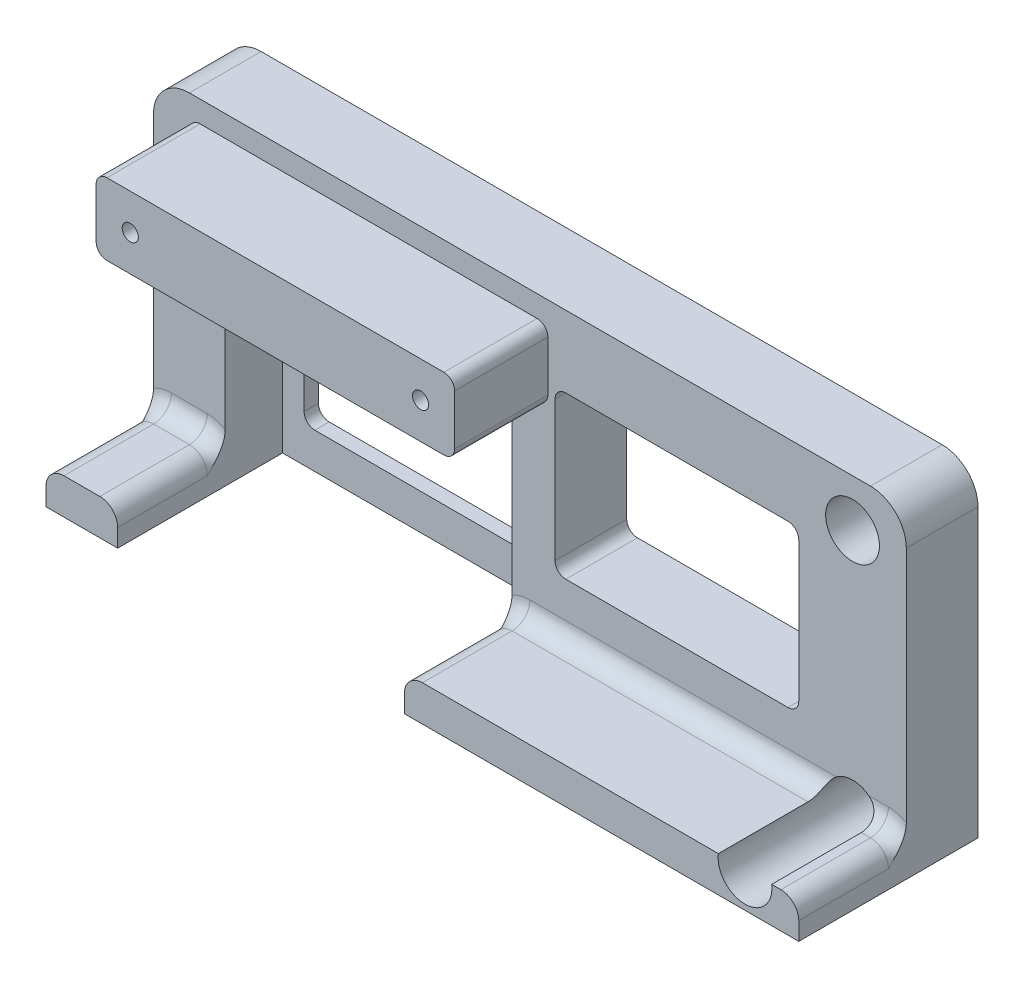
from build123d import *

# Parameters (mm, degrees)
SKETCH1_W           = 210
SKETCH1_H           = 90
BOSS_EXTRUDE1_DEPTH = 20
SKETCH2_R           = 1.6
CUT_EXTRUDE1_DEPTH  = 20
SKETCH3_W           = 110
SKETCH3_H           = 10
BOSS_EXTRUDE2_DEPTH = 30
SKETCH4_W           = 100
SKETCH4_H           = 20
BOSS_EXTRUDE3_DEPTH = 26
SKETCH5_R           = 2.25
CUT_EXTRUDE2_DEPTH  = 234.057932712
SKETCH7_W           = 80
SKETCH7_H           = 64
CUT_EXTRUDE3_DEPTH  = 16
SKETCH8_R           = 7.5
CUT_EXTRUDE4_DEPTH  = 12
SKETCH9_R           = 7.5
CUT_EXTRUDE5_DEPTH  = 42
SKETCH10_W          = 68
SKETCH10_H          = 45
CUT_EXTRUDE6_DEPTH  = 46
SKETCH11_W          = 20
SKETCH11_H          = 10
BOSS_EXTRUDE5_DEPTH = 30
FILLET1_R           = 10
SKETCH12_W          = 68
SKETCH12_H          = 46
CUT_EXTRUDE7_DEPTH  = 30
FILLET2_R           = 5
FILLET3_R           = 5
FILLET4_R           = 3
FILLET5_R           = 3


with BuildPart() as part:
    # Sketch1 → Boss-Extrude1 (new body)
    with BuildSketch(Plane.XY):
        with Locations((105, -45)):
            Rectangle(SKETCH1_W, SKETCH1_H)
    extrude(amount=BOSS_EXTRUDE1_DEPTH)

    # Sketch2 → Cut-Extrude1 (cut)
    with BuildSketch(Plane.XY.offset(20)):
        with Locations((195, -13.2)):
            Circle(SKETCH2_R)
        with Locations((195, -81)):
            Circle(SKETCH2_R)
    extrude(amount=-CUT_EXTRUDE1_DEPTH, mode=Mode.SUBTRACT)

    # Sketch3 → Boss-Extrude2 (add)
    with BuildSketch(Plane.XY.offset(20)):
        with Locations((155, -85)):
            Rectangle(SKETCH3_W, SKETCH3_H)
    extrude(amount=BOSS_EXTRUDE2_DEPTH)

    # Sketch4 → Boss-Extrude3 (add)
    with BuildSketch(Plane.XY.offset(20)):
        with Locations((60, -16)):
            Rectangle(SKETCH4_W, SKETCH4_H)
    extrude(amount=BOSS_EXTRUDE3_DEPTH)

    # Sketch5 → Cut-Extrude2 (cut, through all)
    with BuildSketch(Plane.XY.offset(46)):
        with Locations((100.5, -16)):
            Circle(SKETCH5_R)
        with Locations((19.5, -16)):
            Circle(SKETCH5_R)
    extrude(amount=-CUT_EXTRUDE2_DEPTH, mode=Mode.SUBTRACT)

    # Sketch7 → Cut-Extrude3 (cut)
    with BuildSketch(Plane.XY.offset(20)):
        with Locations((60, -58)):
            Rectangle(SKETCH7_W, SKETCH7_H)
    extrude(amount=-CUT_EXTRUDE3_DEPTH, mode=Mode.SUBTRACT)

    # Sketch8 → Cut-Extrude4 (cut)
    with BuildSketch(Plane.XY.offset(20)):
        with Locations((195, -13.2)):
            Circle(SKETCH8_R)
    extrude(amount=-CUT_EXTRUDE4_DEPTH, mode=Mode.SUBTRACT)

    # Sketch9 → Cut-Extrude5 (cut)
    with BuildSketch(Plane.XY.offset(50)):
        with Locations((195, -81)):
            Circle(SKETCH9_R)
    extrude(amount=-CUT_EXTRUDE5_DEPTH, mode=Mode.SUBTRACT)

    # Sketch10 → Cut-Extrude6 (cut)
    with BuildSketch(Plane.XY.offset(20)):
        with Locations((146, -42.5)):
            Rectangle(SKETCH10_W, SKETCH10_H)
    extrude(amount=-CUT_EXTRUDE6_DEPTH, mode=Mode.SUBTRACT)

    # Sketch11 → Boss-Extrude5 (add)
    with BuildSketch(Plane.XY.offset(20)):
        with Locations((10, -85)):
            Rectangle(SKETCH11_W, SKETCH11_H)
    extrude(amount=BOSS_EXTRUDE5_DEPTH)

    # Fillet1
    fillet1_edges = [part.edges().sort_by_distance(p)[0] for p in [
        (0, 0, 10),
        (210, 0, 10),
    ]]
    fillet(fillet1_edges, radius=FILLET1_R)

    # Sketch12 → Cut-Extrude7 (cut)
    with BuildSketch(Plane.XY.offset(4)):
        with Locations((60, -57)):
            Rectangle(SKETCH12_W, SKETCH12_H)
    extrude(amount=-CUT_EXTRUDE7_DEPTH, mode=Mode.SUBTRACT)

    # Fillet2
    fillet2_edges = [part.edges().sort_by_distance(p)[0] for p in [
        (0, -80, 35),
        (20, -80, 35),
        (210, -80, 35),
        (100, -80, 35),
    ]]
    fillet(fillet2_edges, radius=FILLET2_R)

    # Fillet3
    # the kernel refuses this fillet: 5 mm, written as the material it adds along each edge
    with BuildSketch(Plane(origin=(189.933034374, -80, 20), x_dir=(0, 1, 0), z_dir=(1, 0, 0))) as fillet3_piece_1_section:
        with BuildLine():
            CenterArc((FILLET3_R, FILLET3_R), FILLET3_R, 180, 90)
            Line((0, FILLET3_R), (0, 0))
            Line((0, 0), (FILLET3_R, 0))
        make_face()
    fillet3_piece_1 = extrude(amount=15.066965626, mode=Mode.PRIVATE)
    fillet3_piece_1 = fillet3_piece_1 - Plane(origin=(195, -81, 20.004383527), x_dir=(1, 0, 0), z_dir=(0, 0, 1)) * Cylinder(7.5, 51, mode=Mode.PRIVATE)
    add(fillet3_piece_1)
    with BuildSketch(Plane(origin=(15, -80, 20), x_dir=(0, 1, 0), z_dir=(-1, 0, 0))) as fillet3_piece_2:
        with BuildLine():
            CenterArc((FILLET3_R, -FILLET3_R), FILLET3_R, 90, 90)
            Line((0, -FILLET3_R), (0, 0))
            Line((0, 0), (FILLET3_R, 0))
        make_face()
    extrude(amount=10)
    with BuildSketch(Plane(origin=(205, -85, 20), x_dir=(-0.801744239297649, -0.5976672776328267, 0), z_dir=(-0.5976672776328267, 0.801744239297649, 0))) as fillet3_piece_3_section:
        with BuildLine():
            CenterArc((5 + FILLET3_R, FILLET3_R), FILLET3_R, 180, 90)
            Line((5, FILLET3_R), (5, 0))
            Line((5, 0), (5 + FILLET3_R, 0))
        make_face()
    fillet3_piece_3 = revolve(axis=Axis((205, -85, 20), (0, 0, 1)), revolution_arc=233.296989237, mode=Mode.PRIVATE)
    fillet3_piece_3 = split(fillet3_piece_3, bisect_by=Plane(origin=(208.749694825, -90, 21.558141558), z_dir=(0, 1, 0)), keep=Keep.TOP, mode=Mode.PRIVATE)
    fillet3_piece_3 = split(fillet3_piece_3, bisect_by=Plane(origin=(210, -81.250305307, 21.558141558), z_dir=(-1, 0, 0)), keep=Keep.TOP, mode=Mode.PRIVATE)
    add(fillet3_piece_3)
    with BuildSketch(Plane(origin=(105, -85, 20), x_dir=(0, 1, 0), z_dir=(1, 0, 0))) as fillet3_piece_4_section:
        with BuildLine():
            CenterArc((5 + FILLET3_R, FILLET3_R), FILLET3_R, 180, 90)
            Line((5, FILLET3_R), (5, 0))
            Line((5, 0), (5 + FILLET3_R, 0))
        make_face()
    fillet3_piece_4 = revolve(axis=Axis((105, -85, 20), (0, 0, 1)), revolution_arc=233.296989237, mode=Mode.PRIVATE)
    fillet3_piece_4 = split(fillet3_piece_4, bisect_by=Plane(origin=(103.049091377, -90, 20.836500951), z_dir=(0, 1, 0)), keep=Keep.TOP, mode=Mode.PRIVATE)
    fillet3_piece_4 = split(fillet3_piece_4, bisect_by=Plane(origin=(100, -78.901123736, 20.836500951), z_dir=(1, 0, 0)), keep=Keep.TOP, mode=Mode.PRIVATE)
    add(fillet3_piece_4)
    with BuildSketch(Plane(origin=(15, -85, 20), x_dir=(0, 1, 0), z_dir=(-1, 0, 0))) as fillet3_piece_5_section:
        with BuildLine():
            CenterArc((5 + FILLET3_R, -FILLET3_R), FILLET3_R, 90, 90)
            Line((5, -FILLET3_R), (5, 0))
            Line((5, 0), (5 + FILLET3_R, 0))
        make_face()
    fillet3_piece_5 = revolve(axis=Axis((15, -85, 20), (0, 0, -1)), revolution_arc=233.296989237, mode=Mode.PRIVATE)
    fillet3_piece_5 = split(fillet3_piece_5, bisect_by=Plane(origin=(16.950908623, -90, 20.836500951), z_dir=(0, 1, 0)), keep=Keep.TOP, mode=Mode.PRIVATE)
    fillet3_piece_5 = split(fillet3_piece_5, bisect_by=Plane(origin=(20, -78.901123736, 20.836500951), z_dir=(-1, 0, 0)), keep=Keep.TOP, mode=Mode.PRIVATE)
    add(fillet3_piece_5)
    with BuildSketch(Plane(origin=(5, -85, 20), x_dir=(0.8017442392976476, -0.5976672776328283, 0), z_dir=(0.5976672776328283, 0.8017442392976476, 0))) as fillet3_piece_6_section:
        with BuildLine():
            CenterArc((5 + FILLET3_R, -FILLET3_R), FILLET3_R, 90, 90)
            Line((5, -FILLET3_R), (5, 0))
            Line((5, 0), (5 + FILLET3_R, 0))
        make_face()
    fillet3_piece_6 = revolve(axis=Axis((5, -85, 20), (0, 0, -1)), revolution_arc=233.296989237, mode=Mode.PRIVATE)
    fillet3_piece_6 = split(fillet3_piece_6, bisect_by=Plane(origin=(1.250305308, -90, 21.55814164), z_dir=(0, 1, 0)), keep=Keep.TOP, mode=Mode.PRIVATE)
    fillet3_piece_6 = split(fillet3_piece_6, bisect_by=Plane(origin=(0, -81.250305308, 21.55814164), z_dir=(1, 0, 0)), keep=Keep.TOP, mode=Mode.PRIVATE)
    add(fillet3_piece_6)
    with BuildSketch(Plane(origin=(105, -80, 20), x_dir=(0, 1, 0), z_dir=(1, 0, 0))) as fillet3_piece_7_section:
        with BuildLine():
            CenterArc((FILLET3_R, FILLET3_R), FILLET3_R, 180, 90)
            Line((0, FILLET3_R), (0, 0))
            Line((0, 0), (FILLET3_R, 0))
        make_face()
    fillet3_piece_7 = extrude(amount=95.066965626, mode=Mode.PRIVATE)
    fillet3_piece_7 = fillet3_piece_7 - Plane(origin=(195, -81, 21.114667371), x_dir=(1, 0, 0), z_dir=(0, 0, 1)) * Cylinder(7.5, 211, mode=Mode.PRIVATE)
    add(fillet3_piece_7)

    # Fillet4
    fillet4_edges = [part.edges().sort_by_distance(p)[0] for p in [
        (180, -20, 10),
        (180, -65, 10),
        (26, -80, 2),
        (26, -34, 2),
        (94, -34, 2),
        (94, -80, 2),
        (20, -26, 12),
        (100, -26, 12),
        (112, -65, 10),
        (112, -20, 10),
    ]]
    fillet(fillet4_edges, radius=FILLET4_R)

    # Fillet5
    fillet5_edges = [part.edges().sort_by_distance(p)[0] for p in [
        (10, -6, 33),
        (10, -26, 33),
        (110, -26, 33),
        (110, -6, 33),
    ]]
    fillet(fillet5_edges, radius=FILLET5_R)


solid = part.part
